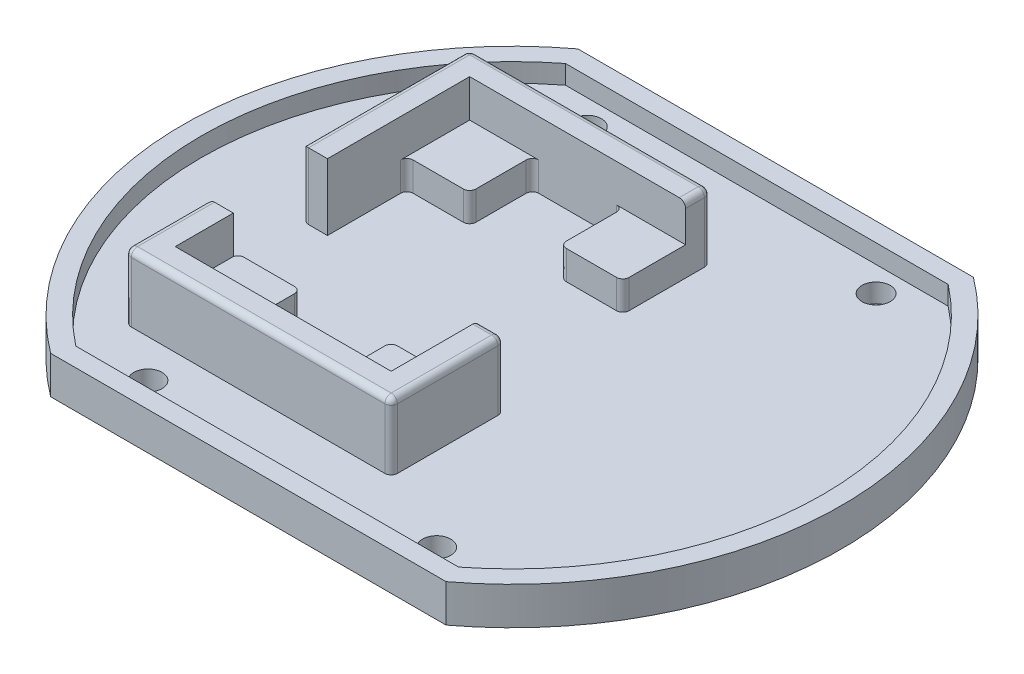
from build123d import *

# Parameters (mm, degrees)
A_BASE_T42_OUTLINE_R       = 2.2479
A_BASE_T42_OUTLINE_R_2     = 1
A_BASE_T42_DEPTH           = 3
OUTER_BRIM_DEPTH           = 3
SKETCH5_W                  = 3
SKETCH5_H                  = 15
SKETCH5_W_2                = 15
SKETCH5_H_2                = 3
BASE_SUPPORTS_DEPTH        = 3
BASE_SUPPORTS_CHAMFER_SIZE = 3
COVER_START                = -3
SKETCH6_R                  = 1
COVER_DEPTH                = 3
SKETCH9_W                  = 15
SKETCH9_H                  = 6
SKETCH9_W_2                = 6
SKETCH9_H_2                = 15
CUT_EXTRUDE1_DEPTH         = 10
SKETCH10_W                 = 10
SKETCH10_H                 = 10
BOSS_EXTRUDE1_DEPTH        = 4.6
BOSS_EXTRUDE2_DEPTH        = 10.6
FILLET1_R                  = 1


with BuildPart() as part:
    # a_base_t42: read off the stored shape, not the designer's step
    # a_base_t42 outline → a_base_t42 (new body)
    with BuildSketch(Plane(origin=(0, 0, 0), x_dir=(1, 0, 0), z_dir=(0, 1, 0))):
        with BuildLine():
            ThreePointArc((31.5, -42), (52.5, 0), (31.5, 42))
            Line((31.5, 42), (-31.5, 42))
            ThreePointArc((-31.5, 42), (-52.5, 0), (-31.5, -42))
            Line((-31.5, -42), (31.5, -42))
        make_face()
        with Locations((-23, -35)):
            Circle(A_BASE_T42_OUTLINE_R, mode=Mode.SUBTRACT)
        with Locations((23, -35)):
            Circle(A_BASE_T42_OUTLINE_R, mode=Mode.SUBTRACT)
        with Locations((-40.25, 0)):
            Circle(A_BASE_T42_OUTLINE_R_2, mode=Mode.SUBTRACT)
        with Locations((-23, 35)):
            Circle(A_BASE_T42_OUTLINE_R, mode=Mode.SUBTRACT)
        with Locations((40.25, 0)):
            Circle(A_BASE_T42_OUTLINE_R_2, mode=Mode.SUBTRACT)
        with Locations((23, 35)):
            Circle(A_BASE_T42_OUTLINE_R, mode=Mode.SUBTRACT)
    extrude(amount=A_BASE_T42_DEPTH)

    # Sketch1 → Outer Brim (add)
    with BuildSketch(Plane(origin=(0, 3, 0), x_dir=(1, 0, 0), z_dir=(0, 1, 0))):
        with BuildLine():
            Line((-31.5, -42), (31.5, -42))
            ThreePointArc((31.5, -42), (52.5, 0), (31.5, 42))
            Line((31.5, 42), (-31.5, 42))
            ThreePointArc((-31.5, 42), (-52.5, 0), (-31.5, -42))
        make_face()
        with BuildLine():
            Line((30.483602149, 39), (-30.483602149, 39))
            ThreePointArc((-30.483602149, 39), (-49.5, 0), (-30.483602149, -39))
            Line((-30.483602149, -39), (30.483602149, -39))
            ThreePointArc((30.483602149, -39), (49.5, 0), (30.483602149, 39))
        make_face(mode=Mode.SUBTRACT)
    extrude(amount=OUTER_BRIM_DEPTH)

    # Sketch5 → Base Supports (add)
    with BuildSketch(Plane(origin=(0, 3, 0), x_dir=(1, 0, 0), z_dir=(0, 1, 0))):
        with Locations((-34.325, -12.5)):
            Rectangle(SKETCH5_W, SKETCH5_H)
        with Locations((-34.325, 12.5)):
            Rectangle(SKETCH5_W, SKETCH5_H)
        with Locations((-25.325, -27)):
            Rectangle(SKETCH5_W_2, SKETCH5_H_2)
        with Locations((-25.325, 27)):
            Rectangle(SKETCH5_W_2, SKETCH5_H_2)
    extrude(amount=BASE_SUPPORTS_DEPTH)

    # Base Supports Chamfer
    base_supports_chamfer_edges = [part.edges().sort_by_distance(p)[0] for p in [
        (-25.325, 3, 28.5),
        (-25.325, 3, -28.5),
        (-35.825, 3, 12.5),
        (-35.825, 3, -12.5),
    ]]
    chamfer(base_supports_chamfer_edges, length=BASE_SUPPORTS_CHAMFER_SIZE - 0.0001)  # a hair under: the kernel refuses the full size

    # Sketch6 → Cover (add)
    with BuildSketch(Plane(origin=(0, 3, 0), x_dir=(1, 0, 0), z_dir=(0, 1, 0)).offset(COVER_START)):
        with Locations((-40.25, 0)):
            Circle(SKETCH6_R)
        with Locations((40.25, 0)):
            Circle(SKETCH6_R)
    extrude(amount=COVER_DEPTH)

    # Sketch9 → Cut-Extrude1 (cut)
    with BuildSketch(Plane(origin=(0, 3, 0), x_dir=(1, 0, 0), z_dir=(0, 1, 0))):
        with Locations((-25.325, 28.5)):
            Rectangle(SKETCH9_W, SKETCH9_H)
        with Locations((-35.825, 12.5)):
            Rectangle(SKETCH9_W_2, SKETCH9_H_2)
        with Locations((-35.825, -12.5)):
            Rectangle(SKETCH9_W_2, SKETCH9_H_2)
        with Locations((-25.325, -28.5)):
            Rectangle(SKETCH9_W, SKETCH9_H)
    extrude(amount=CUT_EXTRUDE1_DEPTH, mode=Mode.SUBTRACT)

    # Sketch10 → Boss-Extrude1 (add)
    with BuildSketch(Plane(origin=(0, 3, 0), x_dir=(1, 0, 0), z_dir=(0, 1, 0))):
        with Locations((-23.7, 16.95)):
            Rectangle(SKETCH10_W, SKETCH10_H)
        with Locations((0.7, 16.95)):
            Rectangle(SKETCH10_W, SKETCH10_H)
        with Locations((0.7, -19.95)):
            Rectangle(SKETCH10_W, SKETCH10_H)
        with Locations((-23.7, -19.95)):
            Rectangle(SKETCH10_W, SKETCH10_H)
    extrude(amount=BOSS_EXTRUDE1_DEPTH)

    # Sketch11 → Boss-Extrude2 (add)
    with BuildSketch(Plane(origin=(0, 3, 0), x_dir=(1, 0, 0), z_dir=(0, 1, 0))):
        Polygon((-28.7, 21.95), (-28.7, -0.7), (-32.7, -0.7), (-32.7, 25.95), (5.7, 25.95), (5.7, 21.95), align=None)
        Polygon((-28.7, -24.95), (-28.7, -15.7), (-32.7, -15.7), (-32.7, -28.95), (9.7, -28.95), (9.7, -10.95), (5.7, -10.95), (5.7, -24.95), align=None)
    extrude(amount=BOSS_EXTRUDE2_DEPTH)

    # Fillet1
    # the kernel refuses this fillet: 1 mm, written as the material it adds along each edge
    with BuildSketch(Plane(origin=(-18.7, 0.5, 24.95), x_dir=(1, 0, 0), z_dir=(0, 1, 0)), Plane(origin=(-4.3, 0.5, 24.95), x_dir=(0, 0, -1), z_dir=(0, 1, 0)), Plane(origin=(5.7, 0.5, 14.95), x_dir=(0, 0, -1), z_dir=(0, 1, 0)), Plane(origin=(-4.3, 0.5, -21.95), x_dir=(-1, 0, 0), z_dir=(0, 1, 0)), Plane(origin=(-18.7, 0.5, -21.95), x_dir=(0, 0, 1), z_dir=(0, 1, 0)), Plane(origin=(-28.7, 0.5, -11.95), x_dir=(0, 0, 1), z_dir=(0, 1, 0))) as fillet1_piece_1:
        with BuildLine():
            CenterArc((FILLET1_R, FILLET1_R), FILLET1_R, 180, 90)
            Line((0, FILLET1_R), (0, 0))
            Line((0, 0), (FILLET1_R, 0))
        make_face()
    extrude(amount=7.1)
    # the kernel refuses this fillet: 1 mm, written as the material it takes off along each edge
    with BuildSketch(Plane(origin=(-31.7, 12.6, 27.95), x_dir=(0, 1, 0), z_dir=(-1, 0, 0))) as fillet1_2_piece_1_section:
        Polygon((0, 0), (FILLET1_R * 1.02, 0), (FILLET1_R * 1.02, -FILLET1_R * 1.02), (0, -FILLET1_R * 1.02), align=None)
    fillet1_2_piece_1 = extrude(amount=FILLET1_R * 1.02, mode=Mode.PRIVATE)
    fillet1_2_piece_1 = fillet1_2_piece_1 - Plane(origin=(-31.7, 12.6, 27.95), x_dir=(0, -0.7071067811865475, -0.7071067811865475), z_dir=(-1, 0, 0)) * Sphere(FILLET1_R, mode=Mode.PRIVATE)
    add(fillet1_2_piece_1, mode=Mode.SUBTRACT)
    with BuildSketch(Plane(origin=(8.7, 12.6, 27.95), x_dir=(1, 0, 0), z_dir=(0, 1, 0))) as fillet1_2_piece_2_section:
        Polygon((0, 0), (FILLET1_R * 1.02, 0), (FILLET1_R * 1.02, -FILLET1_R * 1.02), (0, -FILLET1_R * 1.02), align=None)
    fillet1_2_piece_2 = extrude(amount=FILLET1_R * 1.02, mode=Mode.PRIVATE)
    fillet1_2_piece_2 = fillet1_2_piece_2 - Plane(origin=(8.7, 12.6, 27.95), x_dir=(-0.7071067811865475, 0, -0.7071067811865475), z_dir=(0, 1, 0)) * Sphere(FILLET1_R, mode=Mode.PRIVATE)
    add(fillet1_2_piece_2, mode=Mode.SUBTRACT)
    with BuildSketch(Plane(origin=(8.7, 12.6, 11.95), x_dir=(0, 1, 0), z_dir=(0, 0, -1))) as fillet1_2_piece_3_section:
        Polygon((0, 0), (FILLET1_R * 1.02, 0), (FILLET1_R * 1.02, FILLET1_R * 1.02), (0, FILLET1_R * 1.02), align=None)
    fillet1_2_piece_3 = extrude(amount=FILLET1_R * 1.02, mode=Mode.PRIVATE)
    fillet1_2_piece_3 = fillet1_2_piece_3 - Plane(origin=(8.7, 12.6, 11.95), x_dir=(-0.7071067811865475, -0.7071067811865475, 0), z_dir=(0, 0, -1)) * Sphere(FILLET1_R, mode=Mode.PRIVATE)
    add(fillet1_2_piece_3, mode=Mode.SUBTRACT)
    with BuildSketch(Plane(origin=(4.7, 12.6, -24.95), x_dir=(1, 0, 0), z_dir=(0, 0, -1))) as fillet1_2_piece_4_section:
        Polygon((0, 0), (FILLET1_R * 1.02, 0), (FILLET1_R * 1.02, -FILLET1_R * 1.02), (0, -FILLET1_R * 1.02), align=None)
    fillet1_2_piece_4 = extrude(amount=FILLET1_R * 1.02, mode=Mode.PRIVATE)
    fillet1_2_piece_4 = fillet1_2_piece_4 - Plane(origin=(4.7, 12.6, -24.95), x_dir=(-0.7071067811865475, -0.7071067811865475, 0), z_dir=(0, 0, -1)) * Sphere(FILLET1_R, mode=Mode.PRIVATE)
    add(fillet1_2_piece_4, mode=Mode.SUBTRACT)
    with BuildSketch(Plane(origin=(-31.7, 12.6, -24.95), x_dir=(0, 1, 0), z_dir=(0, 0, -1))) as fillet1_2_piece_5_section:
        Polygon((0, 0), (FILLET1_R * 1.02, 0), (FILLET1_R * 1.02, -FILLET1_R * 1.02), (0, -FILLET1_R * 1.02), align=None)
    fillet1_2_piece_5 = extrude(amount=FILLET1_R * 1.02, mode=Mode.PRIVATE)
    fillet1_2_piece_5 = fillet1_2_piece_5 - Plane(origin=(-31.7, 12.6, -24.95), x_dir=(0.7071067811865475, -0.7071067811865475, 0), z_dir=(0, 0, -1)) * Sphere(FILLET1_R, mode=Mode.PRIVATE)
    add(fillet1_2_piece_5, mode=Mode.SUBTRACT)
    with BuildSketch(Plane(origin=(-32.7, 13.6, 13.2), x_dir=(1, 0, 0), z_dir=(0, 0, 1))) as fillet1_2_piece_6:
        with BuildLine():
            CenterArc((FILLET1_R, -FILLET1_R), FILLET1_R, 90, 90)
            Line((0, -FILLET1_R), (0, 0))
            Line((0, 0), (FILLET1_R, 0))
        make_face()
    extrude(amount=14.75, mode=Mode.SUBTRACT)
    with BuildSketch(Plane(origin=(-31.7, 13.6, 28.95), x_dir=(0, 0, -1), z_dir=(1, 0, 0))) as fillet1_2_piece_7:
        with BuildLine():
            CenterArc((FILLET1_R, -FILLET1_R), FILLET1_R, 90, 90)
            Line((0, -FILLET1_R), (0, 0))
            Line((0, 0), (FILLET1_R, 0))
        make_face()
    extrude(amount=40.4, mode=Mode.SUBTRACT)
    with BuildSketch(Plane(origin=(9.7, 13.6, 27.95), x_dir=(-1, 0, 0), z_dir=(0, 0, -1))) as fillet1_2_piece_8:
        with BuildLine():
            CenterArc((FILLET1_R, -FILLET1_R), FILLET1_R, 90, 90)
            Line((0, -FILLET1_R), (0, 0))
            Line((0, 0), (FILLET1_R, 0))
        make_face()
    extrude(amount=16, mode=Mode.SUBTRACT)
    with BuildSketch(Plane(origin=(5.7, 13.6, -24.95), x_dir=(-1, 0, 0), z_dir=(0, 0, 1))) as fillet1_2_piece_9:
        with BuildLine():
            CenterArc((FILLET1_R, FILLET1_R), FILLET1_R, 180, 90)
            Line((0, FILLET1_R), (0, 0))
            Line((0, 0), (FILLET1_R, 0))
        make_face()
    extrude(amount=5.5, mode=Mode.SUBTRACT)
    with BuildSketch(Plane(origin=(-31.7, 13.6, -25.95), x_dir=(0, 0, 1), z_dir=(1, 0, 0))) as fillet1_2_piece_10:
        with BuildLine():
            CenterArc((FILLET1_R, FILLET1_R), FILLET1_R, 180, 90)
            Line((0, FILLET1_R), (0, 0))
            Line((0, 0), (FILLET1_R, 0))
        make_face()
    extrude(amount=36.4, mode=Mode.SUBTRACT)
    with BuildSketch(Plane(origin=(-32.7, 13.6, 3.2), x_dir=(1, 0, 0), z_dir=(0, 0, -1))) as fillet1_2_piece_11:
        with BuildLine():
            CenterArc((FILLET1_R, FILLET1_R), FILLET1_R, 180, 90)
            Line((0, FILLET1_R), (0, 0))
            Line((0, 0), (FILLET1_R, 0))
        make_face()
    extrude(amount=28.15, mode=Mode.SUBTRACT)
    with BuildSketch(Plane(origin=(-32.7, 3, 0.7), x_dir=(1, 0, 0), z_dir=(0, 1, 0)), Plane(origin=(-32.7, 3, 15.7), x_dir=(0, 0, 1), z_dir=(0, 1, 0))) as fillet1_2_piece_12:
        with BuildLine():
            CenterArc((FILLET1_R, FILLET1_R), FILLET1_R, 180, 90)
            Line((0, FILLET1_R), (0, 0))
            Line((0, 0), (FILLET1_R, 0))
        make_face()
    extrude(amount=13.1, mode=Mode.SUBTRACT)
    with BuildSketch(Plane(origin=(-32.7, 3, -25.95), x_dir=(0, 0, 1), z_dir=(0, 1, 0)), Plane(origin=(5.7, 3, -25.95), x_dir=(-1, 0, 0), z_dir=(0, 1, 0)), Plane(origin=(9.7, 3, 10.95), x_dir=(-1, 0, 0), z_dir=(0, 1, 0)), Plane(origin=(9.7, 3, 28.95), x_dir=(0, 0, -1), z_dir=(0, 1, 0)), Plane(origin=(-32.7, 3, 28.95), x_dir=(1, 0, 0), z_dir=(0, 1, 0))) as fillet1_2_piece_13:
        with BuildLine():
            CenterArc((FILLET1_R, FILLET1_R), FILLET1_R, 180, 90)
            Line((0, FILLET1_R), (0, 0))
            Line((0, 0), (FILLET1_R, 0))
        make_face()
    extrude(amount=9.6, mode=Mode.SUBTRACT)
    with BuildSketch(Plane(origin=(-28.7, 3, 14.95), x_dir=(0, 0, 1), z_dir=(0, 1, 0))) as fillet1_2_piece_14:
        with BuildLine():
            CenterArc((1, 0.968245837), FILLET1_R, 180, 75.522487814)
            Line((0, 0.968245837), (0, 0))
            Line((0, 0), (0.75, 0))
        make_face()
    extrude(amount=7.020614591, mode=Mode.SUBTRACT)
    with BuildSketch(Plane(origin=(-18.7, 3, 14.95), x_dir=(-1, 0, 0), z_dir=(0, 1, 0)), Plane(origin=(-4.3, 3, 14.95), x_dir=(0, 0, 1), z_dir=(0, 1, 0)), Plane(origin=(5.7, 3, -11.95), x_dir=(0, 0, -1), z_dir=(0, 1, 0)), Plane(origin=(-4.3, 3, -11.95), x_dir=(1, 0, 0), z_dir=(0, 1, 0))) as fillet1_2_piece_15:
        with BuildLine():
            CenterArc((FILLET1_R, FILLET1_R), FILLET1_R, 180, 90)
            Line((0, FILLET1_R), (0, 0))
            Line((0, 0), (FILLET1_R, 0))
        make_face()
    extrude(amount=7.1, mode=Mode.SUBTRACT)
    with BuildSketch(Plane(origin=(-18.7, 3, -11.95), x_dir=(-1, 0, 0), z_dir=(0, 1, 0))) as fillet1_2_piece_16:
        with BuildLine():
            CenterArc((FILLET1_R, -FILLET1_R), FILLET1_R, 90, 90)
            Line((0, -FILLET1_R), (0, 0))
            Line((0, 0), (FILLET1_R, 0))
        make_face()
    extrude(amount=7.1, mode=Mode.SUBTRACT)
    with BuildSketch(Plane(origin=(8.7, 13.6, 10.95), x_dir=(0, 0, 1), z_dir=(-1, 0, 0))) as fillet1_2_piece_17:
        with BuildLine():
            CenterArc((FILLET1_R, -FILLET1_R), FILLET1_R, 90, 90)
            Line((0, -FILLET1_R), (0, 0))
            Line((0, 0), (FILLET1_R, 0))
        make_face()
    extrude(amount=5.5, mode=Mode.SUBTRACT)


solid = part.part
